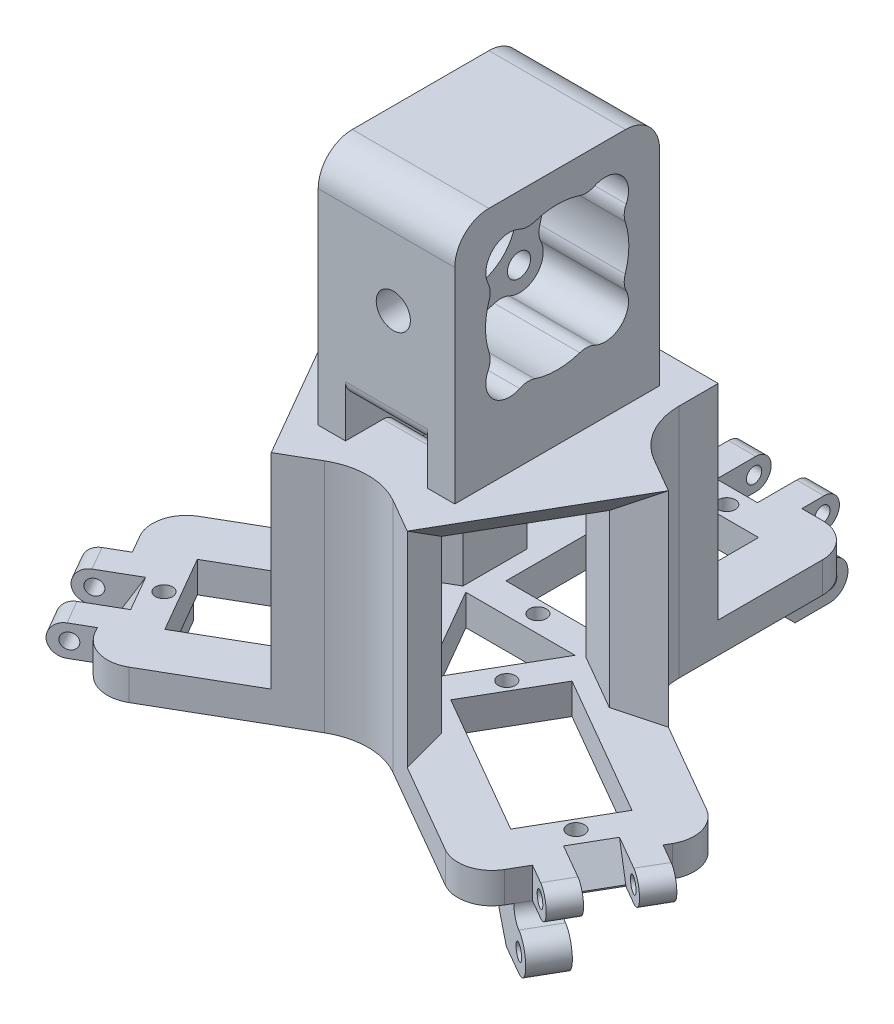
from build123d import *

# Parameters (mm, degrees)
ESQUISSE1_R                                     = 1.25
ESQUISSE1_W                                     = 13
ESQUISSE1_H                                     = 24
BOSS_EXTRU_1_DEPTH                              = 4.5
BOSS_EXTRU_2_START                              = -8
ESQUISSE2_R                                     = 1.125
BOSS_EXTRU_2_DEPTH                              = 14
ESQUISSE3_W                                     = 6
ESQUISSE3_H                                     = 5.5
ENL_V_MAT_EXTRU_1_DEPTH                         = 4.5
BOSS_EXTRU_3_START                              = 7
ESQUISSE4_R                                     = 1.125
BOSS_EXTRU_3_DEPTH                              = 5
BOSS_EXTRU_4_DEPTH                              = 25
ESQUISSE15_R                                    = 2.05
ENL_V_MAT_EXTRU_6_DEPTH                         = 1.25
CONG_7_R                                        = 2
R_P_TITION_CIRCULAIRE1_COUNT                    = 3
CONG_7_OF_R_P_TITION_CIRCULAIRE1_R              = 2
CHANFREIN2_SIZE                                 = 2.5
CHANFREIN2_SIZE2                                = 4.330127019
CHANFREIN3_SIZE                                 = 3
ESQUISSE7_W                                     = 12
ESQUISSE7_H                                     = 15
BOSS_EXTRU_5_DEPTH                              = 5
CHANFREIN6_SIZE                                 = 5
ESQUISSE8_W                                     = 20
ESQUISSE8_H                                     = 30
BOSS_EXTRU_6_DEPTH                              = 35
ENL_V_MAT_EXTRU_2_DEPTH                         = 10
ENL_V_MAT_EXTRU_2_DEPTH_BACK                    = 2.5
ENL_V_MAT_EXTRU_3_REACH                         = 95.579
ESQUISSE10_R                                    = 6.5
CHAMBRAGE_POUR_VIS_T_TE_CYLINDRIQUE_D           = 3.4
CHAMBRAGE_POUR_VIS_T_TE_CYLINDRIQUE_CBORE_D     = 6.4
CHAMBRAGE_POUR_VIS_T_TE_CYLINDRIQUE_CBORE_DEPTH = 4
ESQUISSE13_R                                    = 2.5
ENL_V_MAT_EXTRU_4_DEPTH                         = 15
CONG_1_R                                        = 10
CONG_2_R                                        = 5
CONG_4_R                                        = 5
ENL_V_MAT_EXTRU_5_DEPTH                         = 20
ENL_V_MAT_EXTRU_5_DEPTH_BACK                    = 22.5
ESQUISSE14_W                                    = 12
ESQUISSE14_H                                    = 5.5
CONG_6_R                                        = 2


with BuildPart() as part:
    # Esquisse1 → Boss.-Extru.1 (new body)
    with BuildSketch(Plane(origin=(0, 0, 0), x_dir=(1, 0, 0), z_dir=(0, 1, 0))):
        Polygon((-14, 39.835), (14, 39.835), (14, 8.082903769), (41.49812196, -7.793144347), (27.49812196, -32.041855653), (0, -16.165807537), (-27.49812196, -32.041855653), (-41.49812196, -7.793144347), (-14, 8.082903769), align=None)
        with Locations(Location((-6.205072018, -3.5825, 0), (0, 0, 270))):
            Circle(ESQUISSE1_R, mode=Mode.SUBTRACT)
        with Locations(Location((-30.167994941, -17.4175, 0), (0, 0, 270))):
            Circle(ESQUISSE1_R, mode=Mode.SUBTRACT)
        with Locations(Location((0, 34.835, 0), (0, 0, 270))):
            Circle(ESQUISSE1_R, mode=Mode.SUBTRACT)
        with Locations(Location((0, 7.165, 0), (0, 0, 270))):
            Circle(ESQUISSE1_R, mode=Mode.SUBTRACT)
        with Locations(Location((30.167994941, -17.4175, 0), (0, 0, 270))):
            Circle(ESQUISSE1_R, mode=Mode.SUBTRACT)
        with Locations(Location((6.205072018, -3.5825, 0), (0, 0, 270))):
            Circle(ESQUISSE1_R, mode=Mode.SUBTRACT)
        with Locations((0, 21)):
            Rectangle(ESQUISSE1_W, ESQUISSE1_H, mode=Mode.SUBTRACT)
        Polygon((-31.828838325, -10.870834875), (-11.044228634, 1.129165125), (-4.544228634, -10.129165125), (-25.328838325, -22.129165125), align=None, mode=Mode.SUBTRACT)
        Polygon((11.044228634, 1.129165125), (31.828838325, -10.870834875), (25.328838325, -22.129165125), (4.544228634, -10.129165125), align=None, mode=Mode.SUBTRACT)
        Polygon((8, 4.618802154), (-8, 4.618802154), (0, -9.237604307), align=None, mode=Mode.SUBTRACT)
    extrude(amount=BOSS_EXTRU_1_DEPTH)

    # Esquisse2 → Boss.-Extru.2 (add)
    with BuildSketch(Plane(origin=(0, 0, 0), x_dir=(0, 0, -1), z_dir=(1, 0, 0)).offset(BOSS_EXTRU_2_START)):
        with BuildLine():
            Line((39.835, 4.5), (43.085, 4.5))
            ThreePointArc((43.085, 4.5), (45.335, 2.25), (43.085, 0))
            Line((43.085, 0), (39.835, 0))
            Line((39.835, 0), (39.835, 4.5))
        make_face()
        with Locations((42.835, 2.25)):
            Circle(ESQUISSE2_R, mode=Mode.SUBTRACT)
    boss_extru_2 = extrude(amount=BOSS_EXTRU_2_DEPTH)

    # Esquisse3 → Enlèv. mat.-Extru.1 (cut)
    with BuildSketch(Plane(origin=(0, 4.5, 0), x_dir=(1, 0, 0), z_dir=(0, 1, 0))):
        with Locations((-1, 42.585)):
            Rectangle(ESQUISSE3_W, ESQUISSE3_H)
    enl_v_mat_extru_1 = extrude(amount=-ENL_V_MAT_EXTRU_1_DEPTH, mode=Mode.SUBTRACT)

    # Esquisse4 → Boss.-Extru.3 (add)
    with BuildSketch(Plane(origin=(-4, 0, 0), x_dir=(0, 0, -1), z_dir=(1, 0, 0)).offset(BOSS_EXTRU_3_START)):
        with BuildLine():
            Line((33.835, 0), (33.835, -7.5))
            Line((33.835, -7.5), (41.835, -7.5))
            ThreePointArc((41.835, -7.5), (44.585, -4.75), (41.835, -2))
            Line((41.835, -2), (39.835, -2))
            Line((39.835, -2), (39.835, 0))
            Line((39.835, 0), (33.835, 0))
        make_face()
        with Locations((41.835, -4.75)):
            Circle(ESQUISSE4_R, mode=Mode.SUBTRACT)
    boss_extru_3 = extrude(amount=BOSS_EXTRU_3_DEPTH)

    # Esquisse6 → Boss.-Extru.4 (add)
    with BuildSketch(Plane(origin=(0, 4.5, 0), x_dir=(1, 0, 0), z_dir=(0, 1, 0))):
        Polygon((9, 5.196152423), (9, 14.582903769), (14, 19.582903769), (14, 8.082903769), (23.959292144, 2.332903769), (17.129165125, 0.50277675), align=None)
        Polygon((0, -10.392304845), (8.129165125, -15.085680518), (9.959292144, -21.915807537), (0, -16.165807537), (-9.959292144, -21.915807537), (-8.129165125, -15.085680518), align=None)
        Polygon((-9, 5.196152423), (-17.129165125, 0.50277675), (-23.959292144, 2.332903769), (-14, 8.082903769), (-14, 19.582903769), (-9, 14.582903769), align=None)
    extrude(amount=BOSS_EXTRU_4_DEPTH)

    # Esquisse15 → Enlèv. mat.-Extru.6 (cut)
    with BuildSketch(Plane.ZY.offset(-3)):
        with Locations((-41.835, -4.75)):
            Circle(ESQUISSE15_R)
    enl_v_mat_extru_6 = extrude(amount=-ENL_V_MAT_EXTRU_6_DEPTH, mode=Mode.SUBTRACT)

    # Congé7
    cong_7_edges = [part.edges().sort_by_distance(p)[0] for p in [
        (5.5, -2, -39.835),
    ]]
    fillet(cong_7_edges, radius=CONG_7_R - 0.0001)  # a hair under: the kernel refuses the full size

    # Répétition circulaire1: Boss.-Extru.2, Enlèv. mat.-Extru.1, Boss.-Extru.3, Enlèv. mat.-Extru.6 ×3 about axis
    r_p_tition_circulaire1_axis = Axis((0, 0, 0), (0, 1, 0))
    add([boss_extru_2.rotate(r_p_tition_circulaire1_axis, i * 360 / R_P_TITION_CIRCULAIRE1_COUNT) for i in range(1, R_P_TITION_CIRCULAIRE1_COUNT)])
    add([enl_v_mat_extru_1.rotate(r_p_tition_circulaire1_axis, i * 360 / R_P_TITION_CIRCULAIRE1_COUNT) for i in range(1, R_P_TITION_CIRCULAIRE1_COUNT)], mode=Mode.SUBTRACT)
    add([boss_extru_3.rotate(r_p_tition_circulaire1_axis, i * 360 / R_P_TITION_CIRCULAIRE1_COUNT) for i in range(1, R_P_TITION_CIRCULAIRE1_COUNT)])
    add([enl_v_mat_extru_6.rotate(r_p_tition_circulaire1_axis, i * 360 / R_P_TITION_CIRCULAIRE1_COUNT) for i in range(1, R_P_TITION_CIRCULAIRE1_COUNT)], mode=Mode.SUBTRACT)

    # Congé7 of Répétition circulaire1
    cong_7_of_r_p_tition_circulaire1_edges = [part.edges().sort_by_distance(p)[0] for p in [
        (-37.24812196, -2, 15.154360279),
        (31.74812196, -2, 24.680639721),
    ]]
    fillet(cong_7_of_r_p_tition_circulaire1_edges, radius=CONG_7_OF_R_P_TITION_CIRCULAIRE1_R - 0.0001)  # a hair under: the kernel refuses the full size

    # Chanfrein2
    chanfrein2_edges = [part.edges().sort_by_distance(p)[0] for p in [
        (-1, 4.5, -39.835),
        (34.99812196, 4.5, 19.051474596),
        (-33.99812196, 4.5, 20.783525404),
    ]]
    chanfrein2_side = [part.faces().sort_by_distance(p)[0] for p in [
        (-10.708406009, 4.5, -17.87449776),
    ]]
    chamfer(chanfrein2_edges, length=CHANFREIN2_SIZE, length2=CHANFREIN2_SIZE2, reference=chanfrein2_side[0])

    # Chanfrein3
    chanfrein3_edges = [part.edges().sort_by_distance(p)[0] for p in [
        (5.5, -7.5, -33.835),
        (26.551969537, -7.5, 21.680639721),
        (-32.051969537, -7.5, 12.154360279),
    ]]
    chamfer(chanfrein3_edges, length=CHANFREIN3_SIZE)

    # Esquisse7 → Boss.-Extru.5 (add)
    with BuildSketch(Plane(origin=(0, 29.5, 0), x_dir=(1, 0, 0), z_dir=(0, 1, 0))):
        Polygon((-14, 19.582903769), (-14, 8.082903769), (-23.959292144, 2.332903769), (-9.959292144, -21.915807537), (0, -16.165807537), (9.959292144, -21.915807537), (23.959292144, 2.332903769), (14, 8.082903769), (14, 19.582903769), align=None)
        Rectangle(ESQUISSE7_W, ESQUISSE7_H, mode=Mode.SUBTRACT)
    extrude(amount=BOSS_EXTRU_5_DEPTH)

    # Chanfrein6
    chanfrein6_edges = [part.edges().sort_by_distance(p)[0] for p in [
        (-16.959292144, 29.5, 9.791451884),
        (0, 29.5, -19.582903769),
        (16.959292144, 29.5, 9.791451884),
    ]]
    chamfer(chanfrein6_edges, length=CHANFREIN6_SIZE - 0.0001)  # a hair under: the kernel refuses the full size

    # Esquisse8 → Boss.-Extru.6 (add)
    with BuildSketch(Plane(origin=(0, 34.5, 0), x_dir=(1, 0, 0), z_dir=(0, 1, 0))):
        Rectangle(ESQUISSE8_W, ESQUISSE8_H)
    extrude(amount=BOSS_EXTRU_6_DEPTH)

    # Esquisse9 → Enlèv. mat.-Extru.2 (cut, two sides: drawn at the far end of the back side and taken through both)
    with BuildSketch(Plane(origin=(0, 0, 0), x_dir=(0, 0, -1), z_dir=(1, 0, 0)).offset(-ENL_V_MAT_EXTRU_2_DEPTH_BACK)):
        with BuildLine():
            ThreePointArc((-9.964852675, 57.809336967), (-10.5, 54.5), (-9.964852675, 51.190663033))
            ThreePointArc((-9.964852675, 51.190663033), (-9.822130222, 50.081715769), (-10.106641459, 49.00042622))
            ThreePointArc((-10.106641459, 49.00042622), (-9.439518395, 45.060481605), (-5.49957378, 44.393358541))
            ThreePointArc((-5.49957378, 44.393358541), (-4.418284231, 44.677869778), (-3.309336967, 44.535147325))
            ThreePointArc((-3.309336967, 44.535147325), (0, 44), (3.309336967, 44.535147325))
            ThreePointArc((3.309336967, 44.535147325), (4.418284231, 44.677869778), (5.49957378, 44.393358541))
            ThreePointArc((5.49957378, 44.393358541), (9.439518395, 45.060481605), (10.106641459, 49.00042622))
            ThreePointArc((10.106641459, 49.00042622), (9.822130222, 50.081715769), (9.964852675, 51.190663033))
            ThreePointArc((9.964852675, 51.190663033), (10.5, 54.5), (9.964852675, 57.809336967))
            ThreePointArc((9.964852675, 57.809336967), (9.822130222, 58.918284231), (10.106641459, 59.99957378))
            ThreePointArc((10.106641459, 59.99957378), (9.439518395, 63.939518395), (5.49957378, 64.606641459))
            ThreePointArc((5.49957378, 64.606641459), (4.418284231, 64.322130222), (3.309336967, 64.464852675))
            ThreePointArc((3.309336967, 64.464852675), (0, 65), (-3.309336967, 64.464852675))
            ThreePointArc((-3.309336967, 64.464852675), (-4.418284231, 64.322130222), (-5.49957378, 64.606641459))
            ThreePointArc((-5.49957378, 64.606641459), (-9.439518395, 63.939518395), (-10.106641459, 59.99957378))
            ThreePointArc((-10.106641459, 59.99957378), (-9.822130222, 58.918284231), (-9.964852675, 57.809336967))
        make_face()
    extrude(amount=ENL_V_MAT_EXTRU_2_DEPTH + ENL_V_MAT_EXTRU_2_DEPTH_BACK, mode=Mode.SUBTRACT)

    # Esquisse10 → Enlèv. mat.-Extru.3 (cut, up to next)
    with BuildSketch(Plane(origin=(0, 0, 0), x_dir=(0, 0, -1), z_dir=(1, 0, 0)), mode=Mode.PRIVATE) as enl_v_mat_extru_3_sk1:
        with Locations((0, 54.5)):
            Circle(ESQUISSE10_R)
    enl_v_mat_extru_3_tool1 = extrude(enl_v_mat_extru_3_sk1.sketch, amount=-ENL_V_MAT_EXTRU_3_REACH, mode=Mode.PRIVATE) & part.part
    add(enl_v_mat_extru_3_tool1.solids().sort_by_distance((0, 54.5, 0))[0], mode=Mode.SUBTRACT)

    # Chambrage pour vis à tête cylindrique à 6 pans creux (ou vis CHC) M31 (through all)
    with Locations(Plane.ZY.offset(10)):
        with Locations((6.915, 61.415), (6.915, 47.585), (-6.915, 47.585), (-6.915, 61.415)):
            CounterBoreHole(CHAMBRAGE_POUR_VIS_T_TE_CYLINDRIQUE_D / 2, CHAMBRAGE_POUR_VIS_T_TE_CYLINDRIQUE_CBORE_D / 2, CHAMBRAGE_POUR_VIS_T_TE_CYLINDRIQUE_CBORE_DEPTH)

    # Esquisse13 → Enlèv. mat.-Extru.4 (cut)
    with BuildSketch(Plane.XY):
        with Locations(Location((1, 54.5, 0), (0, 0, 180))):
            Circle(ESQUISSE13_R)
    extrude(amount=ENL_V_MAT_EXTRU_4_DEPTH, mode=Mode.SUBTRACT)

    # Congé1
    cong_1_edges = [part.edges().sort_by_distance(p)[0] for p in [
        (0, 17.25, 16.165807537),
        (-14, 17.25, -8.082903769),
        (14, 17.25, -8.082903769),
    ]]
    fillet(cong_1_edges, radius=CONG_1_R)

    # Congé2
    cong_2_edges = [part.edges().sort_by_distance(p)[0] for p in [
        (41.49812196, 2.25, 7.793144347),
        (27.49812196, 2.25, 32.041855653),
        (-27.49812196, 2.25, 32.041855653),
        (-41.49812196, 2.25, 7.793144347),
        (-14, 2.25, -39.835),
        (14, 2.25, -39.835),
    ]]
    fillet(cong_2_edges, radius=CONG_2_R)

    # Congé4
    cong_4_edges = [part.edges().sort_by_distance(p)[0] for p in [
        (0, 69.5, -15),
        (0, 69.5, 15),
    ]]
    fillet(cong_4_edges, radius=CONG_4_R)

    # Esquisse14 → Enlèv. mat.-Extru.5 (cut, two sides: drawn at the far end of the back side and taken through both)
    with BuildSketch(Plane(origin=(0, 5.05784467, 15), x_dir=(1, 0, 0), z_dir=(0, 0, 1)).offset(-ENL_V_MAT_EXTRU_5_DEPTH_BACK)):
        with Locations((0, 32.19215533)):
            Rectangle(ESQUISSE14_W, ESQUISSE14_H)
    extrude(amount=ENL_V_MAT_EXTRU_5_DEPTH + ENL_V_MAT_EXTRU_5_DEPTH_BACK, mode=Mode.SUBTRACT)

    # Congé6
    cong_6_edges = [part.edges().sort_by_distance(p)[0] for p in [
        (0, 34.5, 7.5),
        (0, 40, 15),
    ]]
    fillet(cong_6_edges, radius=CONG_6_R)


solid = part.part
